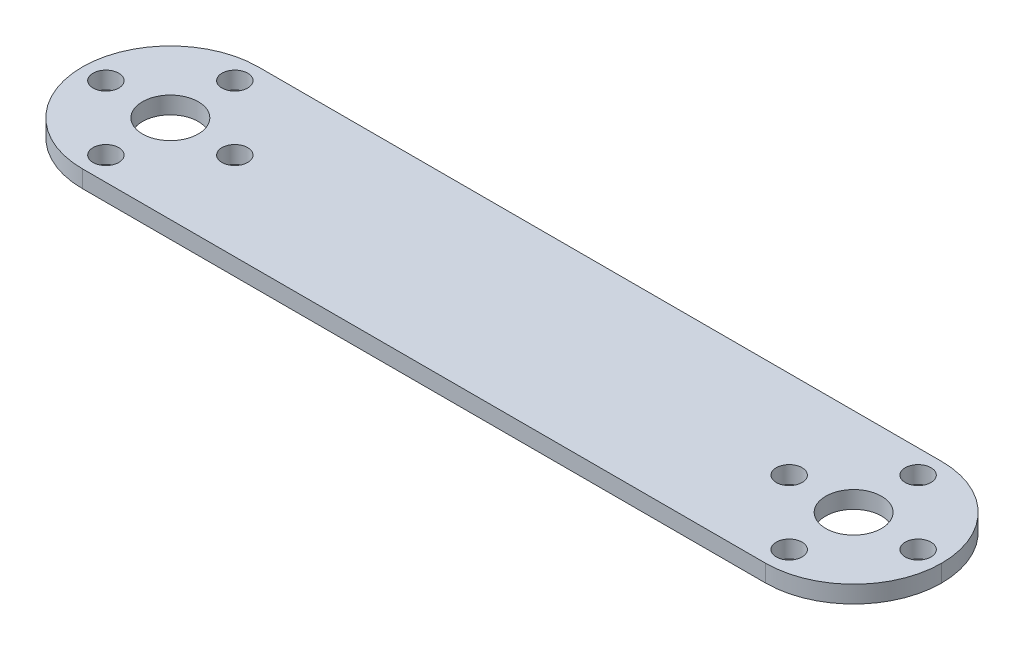
from build123d import *

# Parameters (mm, degrees)
SKETCH1_W           = 100
SKETCH1_H           = 20.5
SKETCH1_R           = 3.25
SKETCH1_R_2         = 1.5
BOSS_EXTRUDE1_DEPTH = 2
FILLET1_R           = 10.25


with BuildPart() as part:
    # Sketch1 → Boss-Extrude1 (new body)
    with BuildSketch(Plane(origin=(0, 0, 0), x_dir=(1, 0, 0), z_dir=(0, 1, 0))):
        with Locations((50, 10.25)):
            Rectangle(SKETCH1_W, SKETCH1_H)
        with Locations(Location((10.25, 10.25, 0), (0, 0, 270))):
            Circle(SKETCH1_R, mode=Mode.SUBTRACT)
        with Locations(Location((17.75, 10.25, 0), (0, 0, 270))):
            Circle(SKETCH1_R_2, mode=Mode.SUBTRACT)
        with Locations(Location((10.25, 17.75, 0), (0, 0, 90))):
            Circle(SKETCH1_R_2, mode=Mode.SUBTRACT)
        with Locations(Location((10.25, 2.75, 0), (0, 0, 90))):
            Circle(SKETCH1_R_2, mode=Mode.SUBTRACT)
        with Locations(Location((2.75, 10.25, 0), (0, 0, 270))):
            Circle(SKETCH1_R_2, mode=Mode.SUBTRACT)
        with Locations(Location((82.25, 10.25, 0), (0, 0, 90))):
            Circle(SKETCH1_R_2, mode=Mode.SUBTRACT)
        with Locations(Location((89.75, 17.75, 0), (0, 0, 270))):
            Circle(SKETCH1_R_2, mode=Mode.SUBTRACT)
        with Locations(Location((89.75, 2.75, 0), (0, 0, 270))):
            Circle(SKETCH1_R_2, mode=Mode.SUBTRACT)
        with Locations(Location((97.25, 10.25, 0), (0, 0, 90))):
            Circle(SKETCH1_R_2, mode=Mode.SUBTRACT)
        with Locations(Location((89.75, 10.25, 0), (0, 0, 90))):
            Circle(SKETCH1_R, mode=Mode.SUBTRACT)
    extrude(amount=BOSS_EXTRUDE1_DEPTH)

    # Fillet1
    fillet1_edges = [part.edges().sort_by_distance(p)[0] for p in [
        (0, 1, 0),
        (0, 1, -20.5),
        (100, 1, -20.5),
        (100, 1, 0),
    ]]
    fillet(fillet1_edges, radius=FILLET1_R - 0.0001)  # a hair under: the kernel refuses the full size


solid = part.part
